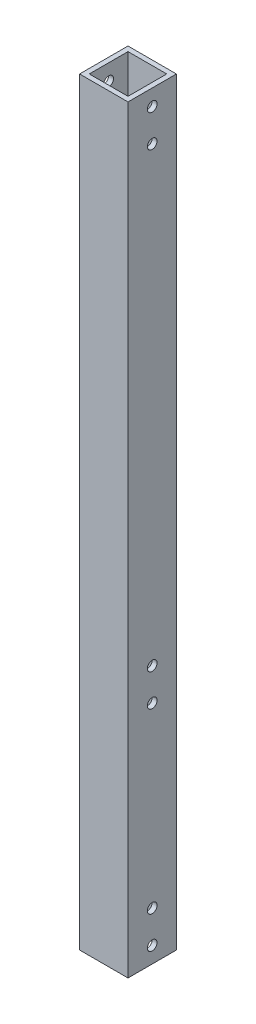
from build123d import *

# Parameters (mm, degrees)
SKETCH1_W              = 15
SKETCH1_H              = 15
SKETCH1_W_2            = 12
SKETCH1_H_2            = 12
EXTRUDE_THIN1_DEPTH    = 235
CUT_EXTRUDE1_OUTLINE_R = 1.5
CUT_EXTRUDE1_DEPTH     = 15
SKETCH3_R              = 1.5
CUT_EXTRUDE2_DEPTH     = 236.95550428


# Read off the part's stored shape, not the designer's step: Cut-Extrude1
with BuildPart() as part:
    # Sketch1 → Extrude-Thin1 (new body)
    with BuildSketch(Plane(origin=(0, 0, 0), x_dir=(1, 0, 0), z_dir=(0, 1, 0))):
        with Locations((7.5, 7.5)):
            Rectangle(SKETCH1_W, SKETCH1_H)
        with Locations((7.5, 7.5)):
            Rectangle(SKETCH1_W_2, SKETCH1_H_2, mode=Mode.SUBTRACT)
    extrude(amount=EXTRUDE_THIN1_DEPTH)

    # Cut-Extrude1 outline → Cut-Extrude1 (cut)
    with BuildSketch(Plane.YZ):
        with Locations((15, -7.5)):
            Circle(CUT_EXTRUDE1_OUTLINE_R)
        with Locations((5, -7.5)):
            Circle(CUT_EXTRUDE1_OUTLINE_R)
        with Locations((220, -7.5)):
            Circle(CUT_EXTRUDE1_OUTLINE_R)
        with Locations((230, -7.5)):
            Circle(CUT_EXTRUDE1_OUTLINE_R)
    extrude(amount=CUT_EXTRUDE1_DEPTH, mode=Mode.SUBTRACT)

    # Sketch3 → Cut-Extrude2 (cut, through all)
    with BuildSketch(Plane(origin=(15, 0, 0), x_dir=(0, 0, -1), z_dir=(1, 0, 0))):
        with Locations((7.5, 80)):
            Circle(SKETCH3_R)
        with Locations((7.5, 70)):
            Circle(SKETCH3_R)
    extrude(amount=-CUT_EXTRUDE2_DEPTH, mode=Mode.SUBTRACT)


solid = part.part
